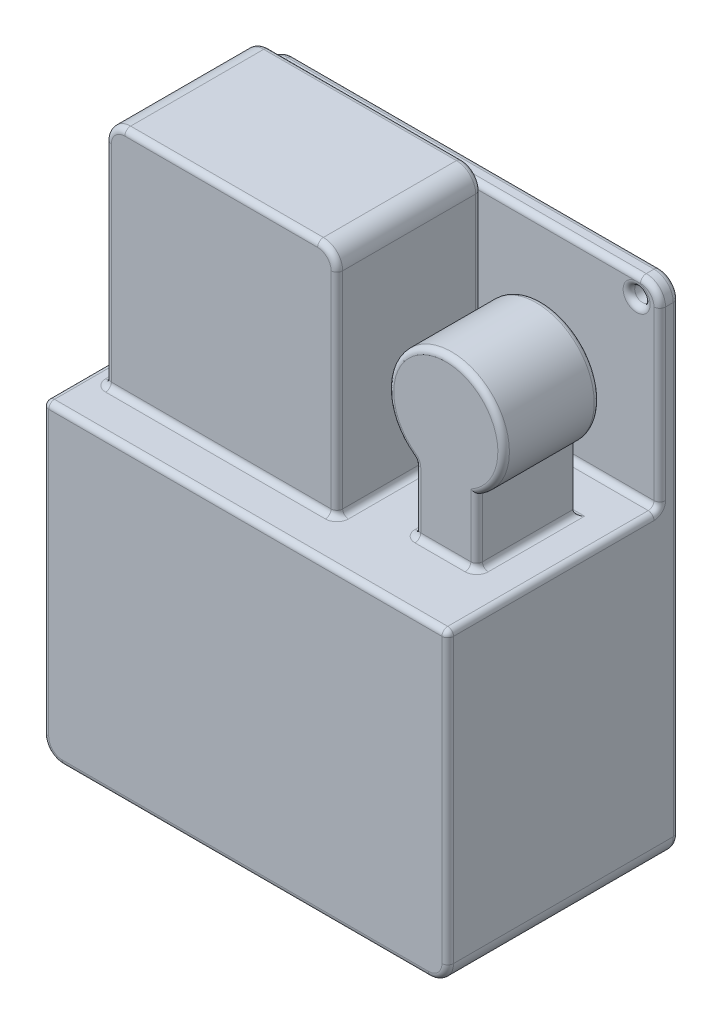
from build123d import *

# Parameters (mm, degrees)
SKETCH_1_W          = 210
SKETCH_1_H          = 160
EXTRUDE_1_DEPTH     = 60
SKETCH_2_W          = 120
SKETCH_2_H          = 75
EXTRUDE_2_DEPTH     = 120
EXTRUDE_3_DEPTH     = 25
SKETCH_4_W          = 210
SKETCH_4_H          = 10
EXTRUDE_4_DEPTH     = 100
SKETCH_5_R          = 4
CUT_EXTRUDE_1_DEPTH = 12
FILLET_1_R          = 10
FILLET_4_R          = 3


with BuildPart() as part:
    # 草图1 → 凸台-拉伸1 (new, symmetric)
    with BuildSketch(Plane.XY):
        Rectangle(SKETCH_1_W, SKETCH_1_H)
    extrude(amount=EXTRUDE_1_DEPTH, both=True)

    # 草图2 → 凸台-拉伸2 (add)
    with BuildSketch(Plane(origin=(0, 80, 0), x_dir=(1, 0, 0), z_dir=(0, 1, 0))):
        with Locations((-35, 0)):
            Rectangle(SKETCH_2_W, SKETCH_2_H)
    extrude(amount=EXTRUDE_2_DEPTH)

    # 草图3 → 凸台-拉伸3 (add, symmetric)
    with BuildSketch(Plane.XY):
        with BuildLine():
            Line((53, 114), (53, 80))
            Line((53, 80), (85, 80))
            Line((85, 80), (85, 114))
            ThreePointArc((85, 114), (69, 169.377155081), (53, 114))
        make_face()
    extrude(amount=EXTRUDE_3_DEPTH, both=True)

    # 草图4 → 凸台-拉伸4 (add)
    with BuildSketch(Plane(origin=(0, 80, 0), x_dir=(1, 0, 0), z_dir=(0, 1, 0))):
        with Locations((0, 55)):
            Rectangle(SKETCH_4_W, SKETCH_4_H)
    extrude(amount=EXTRUDE_4_DEPTH)

    # 草图5 → 切除-拉伸1 (cut)
    with BuildSketch(Plane(origin=(0, 0, -60), x_dir=(-1, 0, 0), z_dir=(0, 0, -1))):
        with Locations((-93, 170)):
            Circle(SKETCH_5_R)
        with Locations((93, 170)):
            Circle(SKETCH_5_R)
    extrude(amount=-CUT_EXTRUDE_1_DEPTH, mode=Mode.SUBTRACT)

    # 圆角1
    fillet_1_edges = [part.edges().sort_by_distance(p)[0] for p in [
        (25, 200, 0),
        (-95, 200, 0),
        (-105, 180, -55),
        (105, 180, -55),
        (105, -80, 0),
        (-105, -80, 0),
    ]]
    fillet(fillet_1_edges, radius=FILLET_1_R)

    # 圆角4
    fillet_4_edges = [part.edges().sort_by_distance(p)[0] for p in [
        (-105, 5, 60),
        (25, 80, 0),
        (-35, 80, -37.5),
        (-95, 80, 0),
        (-35, 80, 37.5),
        (69, 169.377155081, -25),
        (53, 97, -25),
        (53, 114, 0),
        (69, 80, -25),
        (53, 80, 0),
        (85, 80, 0),
        (69, 169.377155081, 25),
        (53, 97, 25),
        (69, 80, 25),
        (85, 97, 25),
        (0, 80, -50),
        (97, 170, -50),
        (97, 170, -60),
        (-89, 170, -50),
        (-89, 170, -60),
        (105, 50, -60),
        (105, 125, -50),
        (105, 5, 60),
        (0, -80, -60),
        (-105, 50, -60),
        (0, 180, -60),
        (102.071067812, 177.071067812, -60),
        (-102.071067812, 177.071067812, -60),
        (-102.071067812, -77.071067812, -60),
        (102.071067812, -77.071067812, -60),
        (0, -80, 60),
        (0, 80, 60),
        (-102.071067812, -77.071067812, 60),
        (102.071067812, -77.071067812, 60),
        (-105, 125, -50),
        (-35, 200, -37.5),
        (-35, 200, 37.5),
        (25, 135, 37.5),
        (-95, 135, 37.5),
        (22.071067812, 197.071067812, 37.5),
        (-105, 80, 5),
        (-92.071067812, 197.071067812, 37.5),
        (-95, 135, -37.5),
        (105, 80, 5),
        (25, 135, -37.5),
        (22.071067812, 197.071067812, -37.5),
        (-92.071067812, 197.071067812, -37.5),
        (0, 180, -50),
        (102.071067812, 177.071067812, -50),
        (-102.071067812, 177.071067812, -50),
    ]]
    fillet(fillet_4_edges, radius=FILLET_4_R - 0.0001)  # a hair under: the kernel refuses the full size


solid = part.part
